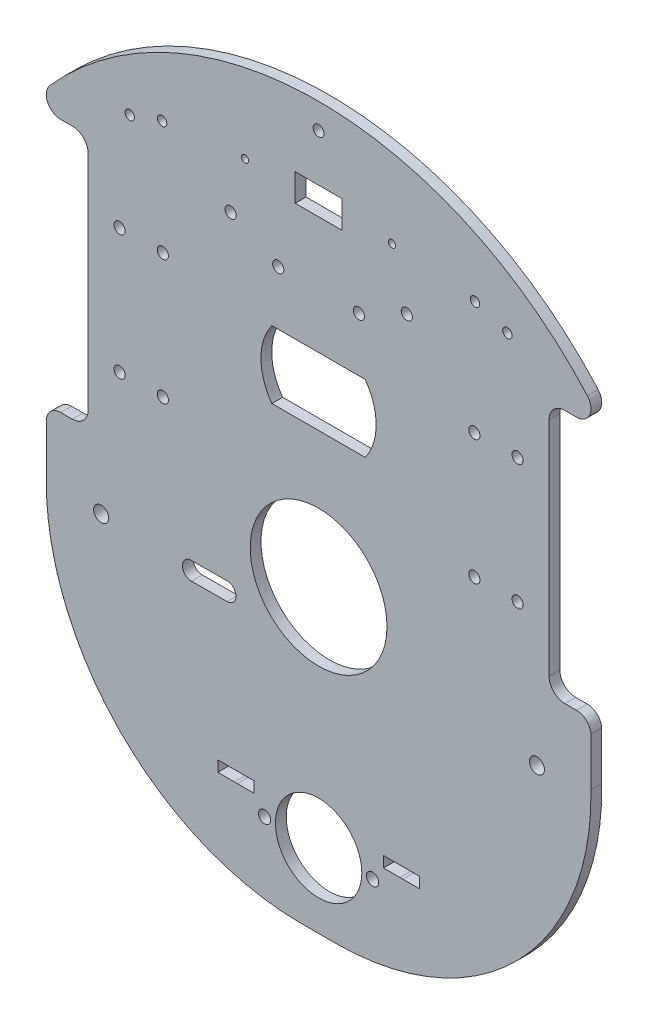
from build123d import *

# Parameters (mm, degrees)
STOCK_ACRYLIC_PARTS_1_OUTLINE_R   = 1.699983
STOCK_ACRYLIC_PARTS_1_OUTLINE_R_2 = 12
STOCK_ACRYLIC_PARTS_1_OUTLINE_R_3 = 2.1
STOCK_ACRYLIC_PARTS_1_OUTLINE_R_4 = 19
STOCK_ACRYLIC_PARTS_1_OUTLINE_R_5 = 1.55
STOCK_ACRYLIC_PARTS_1_OUTLINE_R_6 = 1.3
STOCK_ACRYLIC_PARTS_1_OUTLINE_R_7 = 1
STOCK_ACRYLIC_PARTS_1_OUTLINE_W   = 13
STOCK_ACRYLIC_PARTS_1_OUTLINE_H   = 7.6
STOCK_ACRYLIC_PARTS_1_OUTLINE_R_8 = 1.5
STOCK_ACRYLIC_PARTS_1_DEPTH       = 3
CUT_EXTRUDE1_DEPTH                = 10


# Read off the part's stored shape, not the designer's step: Stock-acrylic parts-1
with BuildPart() as part:
    # Stock-acrylic parts-1 outline → Stock-acrylic parts-1 (new body)
    with BuildSketch(Plane.XY):
        with BuildLine():
            ThreePointArc((821.147949544, 206.202079658), (824.798296467, 208.564256212), (824.138971465, 212.861953418))
            ThreePointArc((824.138971465, 212.861953418), (749.503192804, 246.381695406), (674.867414142, 212.861953418))
            ThreePointArc((674.867414142, 212.861953418), (674.208089141, 208.564256212), (677.858436064, 206.202079658))
            Line((677.858436064, 206.202079658), (681.094663275, 206.202079658))
            ThreePointArc((681.094663275, 206.202079658), (684.210031262, 204.911651986), (685.500458934, 201.796283999))
            Line((685.500458934, 201.796283999), (685.500458934, 140.108329038))
            ThreePointArc((685.500458934, 140.108329038), (684.209895956, 136.992634392), (681.09420131, 135.702071414))
            Line((681.09420131, 135.702071414), (677.866731501, 135.702071414))
            ThreePointArc((677.866731501, 135.702071414), (675.134308532, 134.625733906), (673.870013854, 131.975036511))
            Line((673.870013854, 131.975036511), (673.870013854, 118.558895729))
            ThreePointArc((673.870013854, 118.558895729), (693.951774589, 67.659471727), (744.285774281, 46.199812992))
            Line((744.285774281, 46.199812992), (749.503192804, 46.199785203))
            Line((749.503192804, 46.199785203), (754.720611326, 46.199812992))
            ThreePointArc((754.720611326, 46.199812992), (805.054611018, 67.659471727), (825.136371753, 118.558895729))
            Line((825.136371753, 118.558895729), (825.136371753, 131.975036511))
            ThreePointArc((825.136371753, 131.975036511), (823.872077075, 134.625733906), (821.139654106, 135.702071414))
            Line((821.139654106, 135.702071414), (817.912184297, 135.702071414))
            ThreePointArc((817.912184297, 135.702071414), (814.796489652, 136.992634392), (813.505926674, 140.108329038))
            Line((813.505926674, 140.108329038), (813.505926674, 201.796283999))
            ThreePointArc((813.505926674, 201.796283999), (814.796354345, 204.911651986), (817.911722332, 206.202079658))
            Line((817.911722332, 206.202079658), (821.147949544, 206.202079658))
        make_face()
        with Locations((734.502945377, 66.762651685)):
            Circle(STOCK_ACRYLIC_PARTS_1_OUTLINE_R, mode=Mode.SUBTRACT)
        with Locations((749.502795377, 66.762651685)):
            Circle(STOCK_ACRYLIC_PARTS_1_OUTLINE_R_2, mode=Mode.SUBTRACT)
        with BuildLine():
            Line((721.50260823, 73.962833599), (726.112087485, 73.962833599))
            ThreePointArc((726.112087485, 73.962833599), (726.502609759, 74.012836148), (726.893132033, 73.962833599))
            Line((726.893132033, 73.962833599), (731.502611288, 73.962833599))
            Line((731.502611288, 73.962833599), (731.502611288, 70.962833599))
            Line((731.502611288, 70.962833599), (726.893130503, 70.962838298))
            ThreePointArc((726.893130503, 70.962838298), (726.502608179, 70.912836148), (726.112085956, 70.962839094))
            Line((726.112085956, 70.962839094), (721.50260823, 70.962843794))
            Line((721.50260823, 70.962843794), (721.50260823, 73.962833599))
        make_face(mode=Mode.SUBTRACT)
        with Locations((689.120060972, 116.936022379)):
            Circle(STOCK_ACRYLIC_PARTS_1_OUTLINE_R_3, mode=Mode.SUBTRACT)
        with Locations((749.5, 129.5)):
            Circle(STOCK_ACRYLIC_PARTS_1_OUTLINE_R_4, mode=Mode.SUBTRACT)
        with Locations((764.502645377, 66.762651685)):
            Circle(STOCK_ACRYLIC_PARTS_1_OUTLINE_R, mode=Mode.SUBTRACT)
        with BuildLine():
            Line((767.502605171, 73.962833599), (772.112084426, 73.962833599))
            ThreePointArc((772.112084426, 73.962833599), (772.5026067, 74.012836148), (772.893128974, 73.962833599))
            Line((772.893128974, 73.962833599), (777.50260823, 73.962833599))
            Line((777.50260823, 73.962833599), (777.50260823, 70.962843794))
            Line((777.50260823, 70.962843794), (772.893130503, 70.962839094))
            ThreePointArc((772.893130503, 70.962839094), (772.50260828, 70.912836148), (772.112085956, 70.962838298))
            Line((772.112085956, 70.962838298), (767.502605171, 70.962833599))
            Line((767.502605171, 70.962833599), (767.502605171, 73.962833599))
        make_face(mode=Mode.SUBTRACT)
        with Locations((810.131525065, 116.936022379)):
            Circle(STOCK_ACRYLIC_PARTS_1_OUTLINE_R_3, mode=Mode.SUBTRACT)
        with Locations((694.236958178, 153.599764702)):
            Circle(STOCK_ACRYLIC_PARTS_1_OUTLINE_R_5, mode=Mode.SUBTRACT)
        with Locations((706.236958178, 153.599764702)):
            Circle(STOCK_ACRYLIC_PARTS_1_OUTLINE_R_5, mode=Mode.SUBTRACT)
        with Locations((694.236958178, 188.299764702)):
            Circle(STOCK_ACRYLIC_PARTS_1_OUTLINE_R_5, mode=Mode.SUBTRACT)
        with Locations((706.236958178, 188.299764702)):
            Circle(STOCK_ACRYLIC_PARTS_1_OUTLINE_R_5, mode=Mode.SUBTRACT)
        with BuildLine():
            Line((762.456929776, 167.185618031), (736.521624913, 167.180185031))
            ThreePointArc((736.521624913, 167.180185031), (733.487314362, 176.5518483), (736.51769824, 185.924782019))
            Line((736.51769824, 185.924782019), (762.453003098, 185.930215033))
            ThreePointArc((762.453003098, 185.930215033), (765.487313655, 176.558551758), (762.456929776, 167.185618031))
        make_face(mode=Mode.SUBTRACT)
        with Locations((697.05410976, 216.862387)):
            Circle(STOCK_ACRYLIC_PARTS_1_OUTLINE_R_6, mode=Mode.SUBTRACT)
        with Locations((706.041717574, 219.927474111)):
            Circle(STOCK_ACRYLIC_PARTS_1_OUTLINE_R_6, mode=Mode.SUBTRACT)
        with Locations((725.070137431, 207.45155957)):
            Circle(STOCK_ACRYLIC_PARTS_1_OUTLINE_R_5, mode=Mode.SUBTRACT)
        with Locations((738.285350665, 200.947214569)):
            Circle(STOCK_ACRYLIC_PARTS_1_OUTLINE_R_5, mode=Mode.SUBTRACT)
        with Locations((729.080559, 222.300895)):
            Circle(STOCK_ACRYLIC_PARTS_1_OUTLINE_R_7, mode=Mode.SUBTRACT)
        with Locations((749.500559, 222.390895)):
            Rectangle(STOCK_ACRYLIC_PARTS_1_OUTLINE_W, STOCK_ACRYLIC_PARTS_1_OUTLINE_H, mode=Mode.SUBTRACT)
        with Locations((749.500364247, 239.307685207)):
            Circle(STOCK_ACRYLIC_PARTS_1_OUTLINE_R_8, mode=Mode.SUBTRACT)
        with Locations((792.763770316, 153.599764702)):
            Circle(STOCK_ACRYLIC_PARTS_1_OUTLINE_R_5, mode=Mode.SUBTRACT)
        with BuildLine():
            ThreePointArc((804.766598873, 155.149762121), (806.31942743, 153.599764702), (804.766598873, 152.049767283))
            ThreePointArc((804.766598873, 152.049767283), (803.213770316, 153.599764702), (804.766598873, 155.149762121))
        make_face(mode=Mode.SUBTRACT)
        with Locations((792.763770316, 188.299764702)):
            Circle(STOCK_ACRYLIC_PARTS_1_OUTLINE_R_5, mode=Mode.SUBTRACT)
        with BuildLine():
            ThreePointArc((804.766598873, 189.849762121), (806.31942743, 188.299764702), (804.766598873, 186.749767283))
            ThreePointArc((804.766598873, 186.749767283), (803.213770316, 188.299764702), (804.766598873, 189.849762121))
        make_face(mode=Mode.SUBTRACT)
        with Locations((760.685350665, 200.947214569)):
            Circle(STOCK_ACRYLIC_PARTS_1_OUTLINE_R_5, mode=Mode.SUBTRACT)
        with Locations((773.997959275, 207.45155957)):
            Circle(STOCK_ACRYLIC_PARTS_1_OUTLINE_R_5, mode=Mode.SUBTRACT)
        with Locations((769.890559, 222.300895)):
            Circle(STOCK_ACRYLIC_PARTS_1_OUTLINE_R_7, mode=Mode.SUBTRACT)
        with Locations((792.951231186, 219.927474111)):
            Circle(STOCK_ACRYLIC_PARTS_1_OUTLINE_R_6, mode=Mode.SUBTRACT)
        with Locations((801.938839, 216.862387)):
            Circle(STOCK_ACRYLIC_PARTS_1_OUTLINE_R_6, mode=Mode.SUBTRACT)
    extrude(amount=STOCK_ACRYLIC_PARTS_1_DEPTH)

    # Sketch1 → Cut-Extrude1 (cut)
    with BuildSketch(Plane.XY.offset(3)):
        with BuildLine():
            Line((714.154659638, 118.266857616), (724.054510642, 118.321172443))
            ThreePointArc((724.054510642, 118.321172443), (726.561350155, 115.841690031), (724.081867742, 113.334850517))
            Line((724.081867742, 113.334850517), (714.182016738, 113.28053569))
            ThreePointArc((714.182016738, 113.28053569), (711.675177225, 115.760018102), (714.154659638, 118.266857616))
        make_face()
    extrude(amount=-CUT_EXTRUDE1_DEPTH, mode=Mode.SUBTRACT)


solid = part.part
